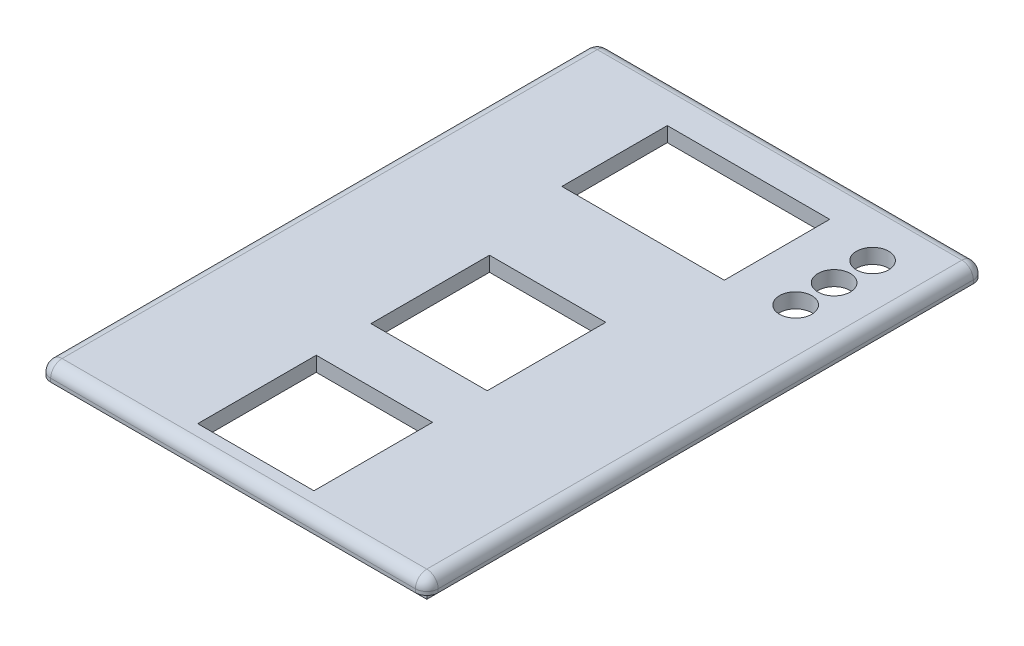
from build123d import *

# Parameters (mm, degrees)
SKETCH1_W           = 86.36
SKETCH1_H           = 124.333
BOSS_EXTRUDE1_DEPTH = 3.302
SKETCH2_W           = 81.28
SKETCH2_H           = 119.253
BOSS_EXTRUDE2_DEPTH = 2.54
CUT_EXTRUDE1_DEPTH  = 2.54
SKETCH6_W           = 25.908
SKETCH6_H           = 26.416
SKETCH6_W_2         = 36.195
SKETCH6_H_2         = 23.495
CUT_EXTRUDE2_DEPTH  = 3.302
FILLET1_R           = 2.54
SKETCH7_R           = 3.6
CUT_EXTRUDE3_DEPTH  = 152.495456872


with BuildPart() as part:
    # Sketch1 → Boss-Extrude1 (new body)
    with BuildSketch(Plane(origin=(0, 0, 0), x_dir=(1, 0, 0), z_dir=(0, 1, 0))):
        with Locations((43.18, 62.1665)):
            Rectangle(SKETCH1_W, SKETCH1_H)
    extrude(amount=BOSS_EXTRUDE1_DEPTH)

    # Sketch2 → Boss-Extrude2 (add)
    with BuildSketch(Plane.XZ):
        with Locations((43.18, -62.1665)):
            Rectangle(SKETCH2_W, SKETCH2_H)
    extrude(amount=BOSS_EXTRUDE2_DEPTH)

    # Sketch4 → Cut-Extrude1 (cut)
    with BuildSketch(Plane.XZ.offset(2.54)):
        Polygon((58.42, -121.793), (58.42, -119.253), (81.28, -119.253), (81.28, -5.08), (58.42, -5.08), (58.42, -2.54), (27.94, -2.54), (27.94, -5.08), (5.08, -5.08), (5.08, -119.253), (27.94, -119.253), (27.94, -121.793), align=None)
    extrude(amount=-CUT_EXTRUDE1_DEPTH, mode=Mode.SUBTRACT)

    # Sketch6 → Cut-Extrude2 (cut)
    with BuildSketch(Plane(origin=(0, 3.302, 0), x_dir=(1, 0, 0), z_dir=(0, 1, 0))):
        with Locations((43.18, 18.288)):
            Rectangle(SKETCH6_W, SKETCH6_H)
        with Locations((43.18, 56.896)):
            Rectangle(SKETCH6_W, SKETCH6_H)
        with Locations((43.1165, 103.1875)):
            Rectangle(SKETCH6_W_2, SKETCH6_H_2)
    extrude(amount=-CUT_EXTRUDE2_DEPTH, mode=Mode.SUBTRACT)

    # Fillet1
    fillet1_edges = [part.edges().sort_by_distance(p)[0] for p in [
        (86.36, 3.302, -62.1665),
        (43.18, 3.302, 0),
        (43.18, 3.302, -124.333),
        (0, 3.302, -62.1665),
        (0, 1.651, -124.333),
        (0, 1.651, 0),
        (86.36, 1.651, 0),
        (86.36, 1.651, -124.333),
    ]]
    fillet(fillet1_edges, radius=FILLET1_R)

    # Sketch7 → Cut-Extrude3 (cut, through all)
    with BuildSketch(Plane(origin=(0, 3.302, 0), x_dir=(1, 0, 0), z_dir=(0, 1, 0))):
        with Locations((73.94287014, 111.76)):
            Circle(SKETCH7_R)
        with Locations((73.94287014, 103.1875)):
            Circle(SKETCH7_R)
        with Locations((73.94287014, 94.615)):
            Circle(SKETCH7_R)
    extrude(amount=-CUT_EXTRUDE3_DEPTH, mode=Mode.SUBTRACT)


solid = part.part
